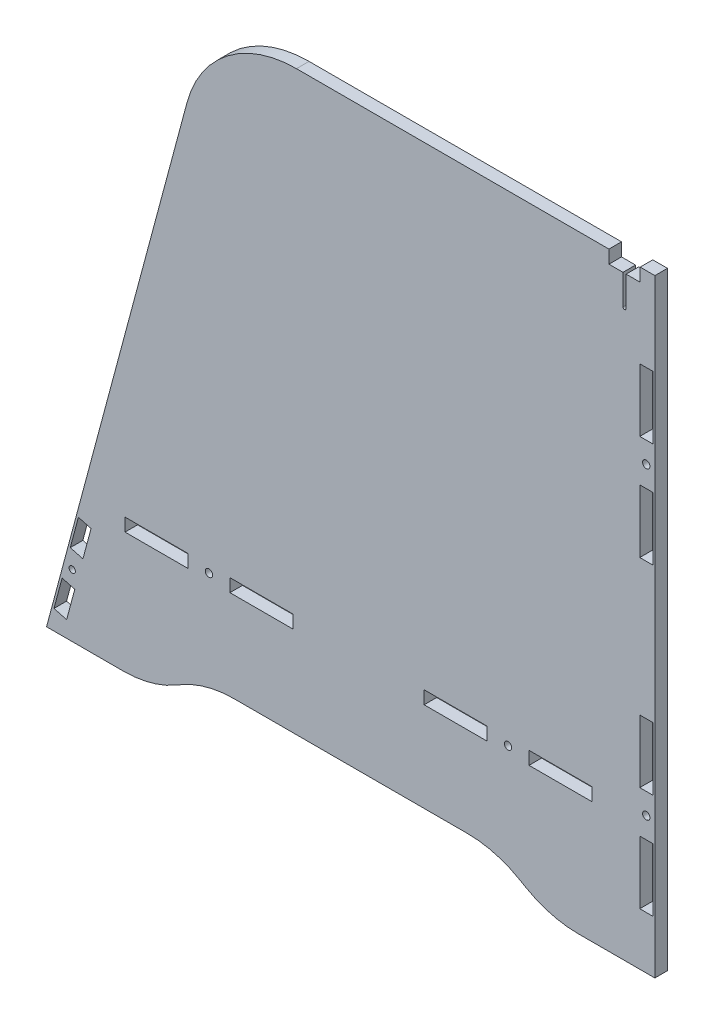
from build123d import *

# Parameters (mm, degrees)
ESBO_O1_R                = 1.75
ESBO_O1_W                = 30
ESBO_O1_H                = 6.2
ESBO_O1_W_2              = 6.2
ESBO_O1_H_2              = 30
RESSALTO_EXTRUS_O1_DEPTH = 6
FILETE1_R                = 54
FILETE2_R                = 50
ESBO_O2_W                = 14.9
ESBO_O2_H                = 6
CORTE_EXTRUS_O1_DEPTH    = 6.25
ESBO_O3_W                = 1.5
ESBO_O3_H                = 15
CORTE_EXTRUS_O2_DEPTH    = 10
FILETE3_R                = 0.75
CORTE_EXTRUS_O3_DEPTH    = 22


with BuildPart() as part:
    # Esboço1 → Ressalto-extrusão1 (new body)
    with BuildSketch(Plane.XY):
        Polygon((125, -165), (75, -165), (49.019237886, -150), (-89.019237886, -150), (-115, -165), (-165, -165), (-87.294734195, 125), (125, 125), align=None)
        with Locations((-87.583302492, -104.1)):
            Circle(ESBO_O1_R, mode=Mode.SUBTRACT)
        with Locations((120.9, 45)):
            Circle(ESBO_O1_R, mode=Mode.SUBTRACT)
        with Locations((55, -104.1)):
            Circle(ESBO_O1_R, mode=Mode.SUBTRACT)
        with Locations((120.9, -100)):
            Circle(ESBO_O1_R, mode=Mode.SUBTRACT)
        with Locations((80, -104.1)):
            Rectangle(ESBO_O1_W, ESBO_O1_H, mode=Mode.SUBTRACT)
        with Locations((30, -104.1)):
            Rectangle(ESBO_O1_W, ESBO_O1_H, mode=Mode.SUBTRACT)
        with Locations((-112.583302492, -104.1)):
            Rectangle(ESBO_O1_W, ESBO_O1_H, mode=Mode.SUBTRACT)
        with Locations((-62.583302492, -104.1)):
            Rectangle(ESBO_O1_W, ESBO_O1_H, mode=Mode.SUBTRACT)
        with Locations((120.9, 70)):
            Rectangle(ESBO_O1_W_2, ESBO_O1_H_2, mode=Mode.SUBTRACT)
        with Locations((120.9, 20)):
            Rectangle(ESBO_O1_W_2, ESBO_O1_H_2, mode=Mode.SUBTRACT)
        with Locations((120.9, -125)):
            Rectangle(ESBO_O1_W_2, ESBO_O1_H_2, mode=Mode.SUBTRACT)
        with Locations((120.9, -75)):
            Rectangle(ESBO_O1_W_2, ESBO_O1_H_2, mode=Mode.SUBTRACT)
    extrude(amount=RESSALTO_EXTRUS_O1_DEPTH)

    # Filete1
    filete1_edges = [part.edges().sort_by_distance(p)[0] for p in [
        (-87.294734195, 125, 3),
    ]]
    fillet(filete1_edges, radius=FILETE1_R)

    # Filete2
    filete2_edges = [part.edges().sort_by_distance(p)[0] for p in [
        (75, -165, 3),
        (49.019237886, -150, 3),
        (-89.019237886, -150, 3),
        (-115, -165, 3),
    ]]
    fillet(filete2_edges, radius=FILETE2_R)

    # Esboço2 → Corte-extrusão1 (cut)
    with BuildSketch(Plane(origin=(0, 125, 0), x_dir=(1, 0, 0), z_dir=(0, 1, 0))):
        with Locations((110.55, -3)):
            Rectangle(ESBO_O2_W, ESBO_O2_H)
    extrude(amount=-CORTE_EXTRUS_O1_DEPTH, mode=Mode.SUBTRACT)

    # Esboço3 → Corte-extrusão2 (cut)
    with BuildSketch(Plane.XY.offset(6)):
        with Locations((110.55, 111.25)):
            Rectangle(ESBO_O3_W, ESBO_O3_H)
    extrude(amount=-CORTE_EXTRUS_O2_DEPTH, mode=Mode.SUBTRACT)

    # Filete3
    filete3_edges = [part.edges().sort_by_distance(p)[0] for p in [
        (111.3, 103.75, 3),
        (109.8, 103.75, 3),
    ]]
    fillet(filete3_edges, radius=FILETE3_R - 0.0001)  # a hair under: the kernel refuses the full size

    # Esboço4 → Corte-extrusão3 (cut)
    with BuildSketch(Plane.XY.offset(6)):
        Polygon((-149.813874716, -112.188312175), (-153.696160392, -126.677199569), (-150.677642185, -127.486009085), (-146.795356509, -112.997121691), align=None)
        Polygon((-146.795356509, -112.997121691), (-150.677642185, -127.486009085), (-147.659123978, -128.294818601), (-143.776838302, -113.805931207), align=None)
        with BuildLine():
            ThreePointArc((-152.367408211, -133.792301745), (-154.204525518, -134.852961916), (-153.143865346, -136.690079223))
            Line((-153.143865346, -136.690079223), (-152.367408211, -133.792301745))
        make_face()
        with BuildLine():
            Line((-152.367408211, -133.792301745), (-153.143865346, -136.690079223))
            ThreePointArc((-153.143865346, -136.690079223), (-151.842494635, -136.431220494), (-151.255636778, -135.241190484))
            ThreePointArc((-151.255636778, -135.241190484), (-151.565606768, -134.328048341), (-152.367408211, -133.792301745))
        make_face()
        Polygon((-157.578446069, -141.166086963), (-161.460731746, -155.654974358), (-158.442213538, -156.463783874), (-154.559927862, -141.974896479), align=None)
        Polygon((-154.559927862, -141.974896479), (-158.442213538, -156.463783874), (-155.423695331, -157.27259339), (-151.541409655, -142.783705995), align=None)
    extrude(amount=-CORTE_EXTRUS_O3_DEPTH, mode=Mode.SUBTRACT)


solid = part.part
